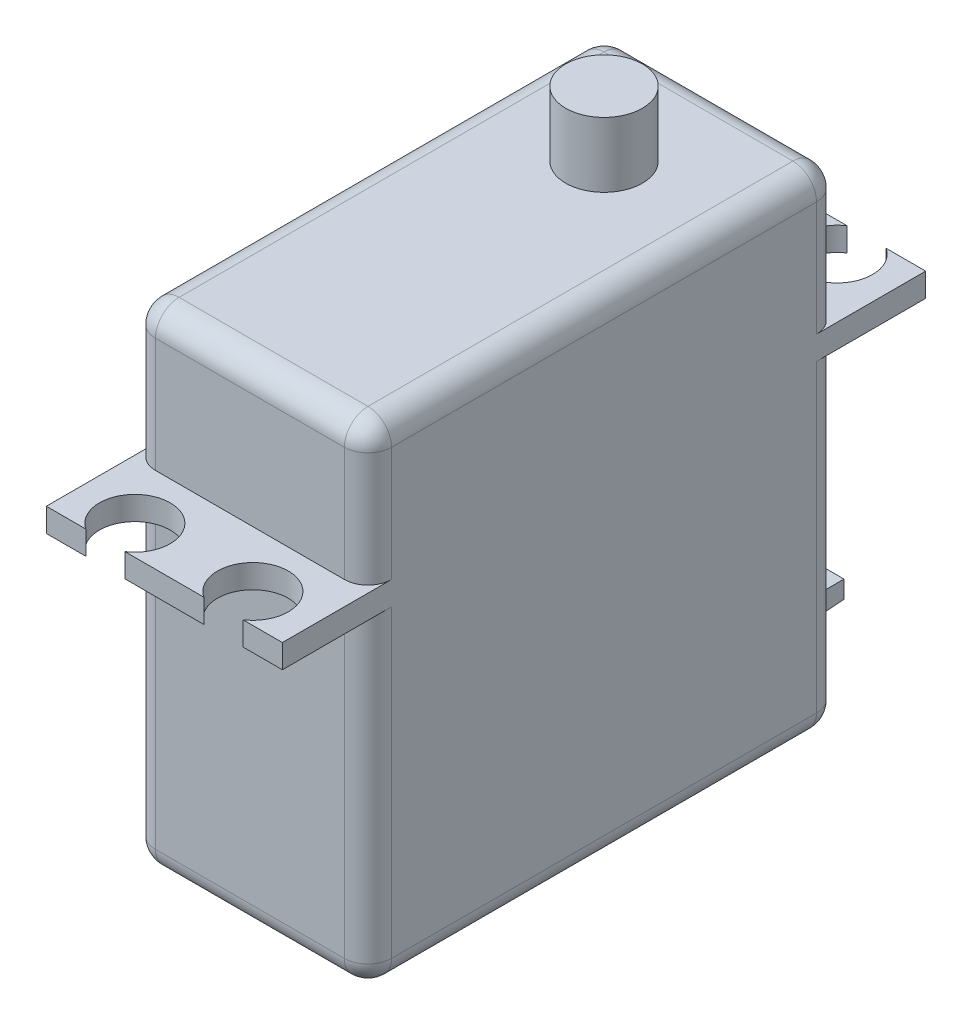
from build123d import *

# Parameters (mm, degrees)
BOSS_EXTRUDE1_DEPTH      = 13.7
BOSS_EXTRUDE1_DEPTH_BACK = 27.8
SKETCH1_W                = 20
SKETCH1_H                = 40
SKETCH4_W                = 20
SKETCH4_H                = 54.5
BOSS_EXTRUDE2_DEPTH      = 2
SKETCH5_R                = 3
CUT_EXTRUDE1_DEPTH       = 42.600510814
SKETCH6_R                = 3.25
BOSS_EXTRUDE3_DEPTH      = 5.5
SKETCH7_W                = 6.666666666
SKETCH7_H                = 2
BOSS_EXTRUDE4_DEPTH      = 7.25
BOSS_EXTRUDE4_TAPER      = 2
FILLET1_R                = 2


with BuildPart() as part:
    # Sketch1 → Boss-Extrude1 (new, two sides: drawn at the far end of the back side and taken through both)
    with BuildSketch(Plane(origin=(0, 0, 0), x_dir=(1, 0, 0), z_dir=(0, 1, 0)).offset(-BOSS_EXTRUDE1_DEPTH_BACK)):
        Rectangle(SKETCH1_W, SKETCH1_H)
    extrude(amount=BOSS_EXTRUDE1_DEPTH + BOSS_EXTRUDE1_DEPTH_BACK)

    # Sketch4 → Boss-Extrude2 (add)
    with BuildSketch(Plane(origin=(0, 0, 0), x_dir=(1, 0, 0), z_dir=(0, 1, 0))):
        Rectangle(SKETCH4_W, SKETCH4_H)
    extrude(amount=BOSS_EXTRUDE2_DEPTH)

    # Sketch5 → Cut-Extrude1 (cut, through all)
    with BuildSketch(Plane(origin=(0, 2, 0), x_dir=(1, 0, 0), z_dir=(0, 1, 0))):
        with Locations((-5, 24.75)):
            Circle(SKETCH5_R)
        with Locations((5, 24.75)):
            Circle(SKETCH5_R)
        with Locations((-5, -24.75)):
            Circle(SKETCH5_R)
        with Locations((5, -24.75)):
            Circle(SKETCH5_R)
    extrude(amount=-CUT_EXTRUDE1_DEPTH, mode=Mode.SUBTRACT)

    # Sketch6 → Boss-Extrude3 (add)
    with BuildSketch(Plane(origin=(0, 13.7, 0), x_dir=(1, 0, 0), z_dir=(0, 1, 0))):
        with Locations(Location((0, 10, 0), (0, 0, 90))):
            Circle(SKETCH6_R)
    extrude(amount=BOSS_EXTRUDE3_DEPTH)

    # Sketch7 → Boss-Extrude4 (add)
    with BuildSketch(Plane(origin=(0, 0, -20), x_dir=(-1, 0, 0), z_dir=(0, 0, -1))):
        with Locations((0, -24.8)):
            Rectangle(SKETCH7_W, SKETCH7_H)
    extrude(amount=BOSS_EXTRUDE4_DEPTH, taper=BOSS_EXTRUDE4_TAPER)

    # Fillet1
    fillet1_edges = [part.edges().sort_by_distance(p)[0] for p in [
        (10, -27.8, 0),
        (0, -27.8, 20),
        (-10, -27.8, 0),
        (0, -27.8, -20),
        (-10, 13.7, 0),
        (0, 13.7, 20),
        (-10, -13.9, 20),
        (10, -13.9, 20),
        (-10, -13.9, -20),
        (10, -13.9, -20),
        (10, 13.7, 0),
        (10, 7.85, 20),
        (-10, 7.85, 20),
        (-10, 7.85, -20),
        (10, 7.85, -20),
        (0, 13.7, -20),
    ]]
    fillet(fillet1_edges, radius=FILLET1_R - 0.0001)  # a hair under: the kernel refuses the full size


solid = part.part
